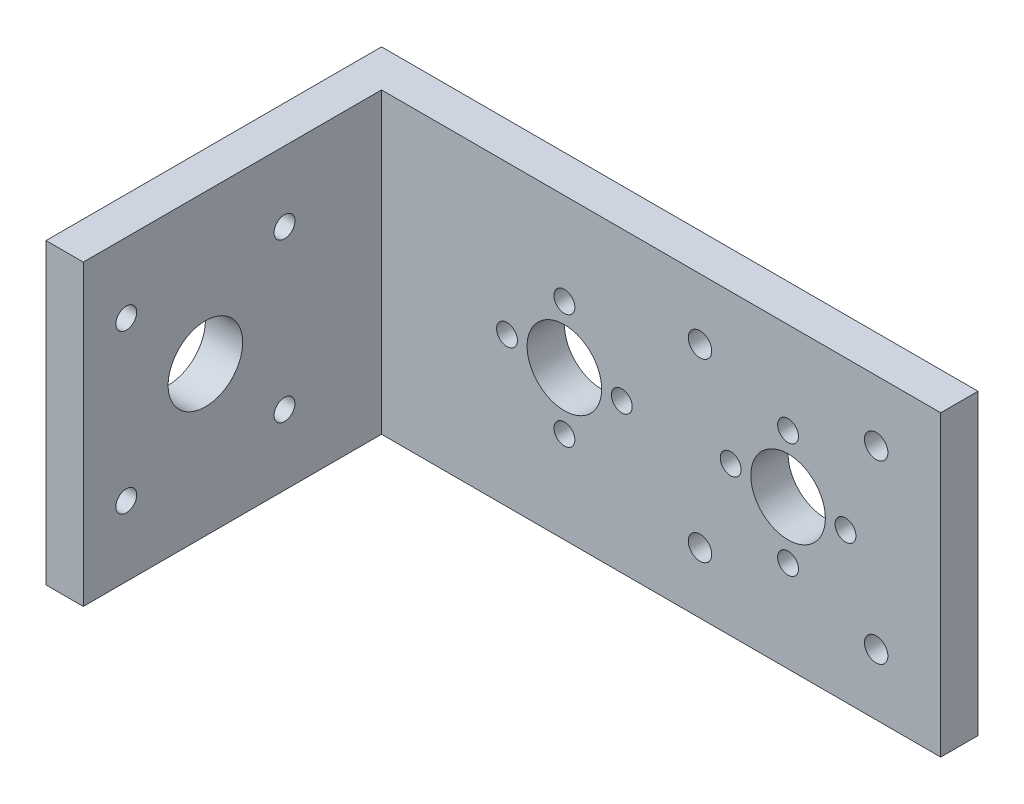
from build123d import *

# Parameters (mm, degrees)
SKETCH1_W                 = 101.6
SKETCH1_H                 = 50.8
BOSS_EXTRUDE1_DEPTH       = 6.35
SKETCH2_R                 = 2
CUT_EXTRUDE1_DEPTH        = 6.35
SKETCH3_R                 = 1.778
CUT_EXTRUDE2_DEPTH        = 6.35
SKETCH4_R                 = 6.35
CUT_EXTRUDE3_DEPTH        = 6.35
CIRPATTERN1_COUNT         = 4
SKETCH5_W                 = 6.35
SKETCH5_H                 = 50.8
BOSS_EXTRUDE2_DEPTH       = 50.8
SKETCH6_R                 = 6.35
CUT_EXTRUDE4_DEPTH        = 6.35
SKETCH7_R                 = 1.778
CUT_EXTRUDE5_DEPTH        = 6.35
CIRPATTERN2_COUNT         = 4
LPATTERN1_COUNT           = 2
LPATTERN1_PITCH           = 38.1
LPATTERN1_COPY_1_SKETCH_R = 1.778
LPATTERN1_COPY_1_DEPTH    = 6.35
LPATTERN1_COPY_2_SKETCH_R = 1.778
LPATTERN1_COPY_2_DEPTH    = 6.35
LPATTERN1_COPY_3_SKETCH_R = 1.778
LPATTERN1_COPY_3_DEPTH    = 6.35
LPATTERN1_COPY_4_SKETCH_R = 1.778
LPATTERN1_COPY_4_DEPTH    = 6.35


with BuildPart() as part:
    # Sketch1 → Boss-Extrude1 (new body)
    with BuildSketch(Plane.XY):
        with Locations((-50.8, -25.4)):
            Rectangle(SKETCH1_W, SKETCH1_H)
    extrude(amount=BOSS_EXTRUDE1_DEPTH)

    # Sketch2 → Cut-Extrude1 (cut)
    with BuildSketch(Plane.XY.offset(6.35)):
        with Locations((-11, -10.400000028)):
            Circle(SKETCH2_R)
        with Locations((-41, -10.400000028)):
            Circle(SKETCH2_R)
        with Locations((-41, -40.399999972)):
            Circle(SKETCH2_R)
        with Locations((-11, -40.399999972)):
            Circle(SKETCH2_R)
    extrude(amount=-CUT_EXTRUDE1_DEPTH, mode=Mode.SUBTRACT)

    # Sketch3 → Cut-Extrude2 (cut)
    with BuildSketch(Plane.XY.offset(6.35)):
        with Locations((-26, -15.621)):
            Circle(SKETCH3_R)
    cut_extrude2 = extrude(amount=-CUT_EXTRUDE2_DEPTH, mode=Mode.SUBTRACT)

    # Sketch4 → Cut-Extrude3 (cut)
    with BuildSketch(Plane.XY.offset(6.35)):
        with Locations((-26, -25.4)):
            Circle(SKETCH4_R)
    cut_extrude3 = extrude(amount=-CUT_EXTRUDE3_DEPTH, mode=Mode.SUBTRACT)

    # CirPattern1: Cut-Extrude2 ×4 about axis
    cirpattern1_axis = Axis((-26, -25.4, 6.35), (0, 0, 1))
    for i in range(1, CIRPATTERN1_COUNT):
        add(cut_extrude2.rotate(cirpattern1_axis, i * 360 / CIRPATTERN1_COUNT), mode=Mode.SUBTRACT)

    # Sketch5 → Boss-Extrude2 (add)
    with BuildSketch(Plane.XY.offset(6.35)):
        with Locations((-98.425, -25.4)):
            Rectangle(SKETCH5_W, SKETCH5_H)
    extrude(amount=BOSS_EXTRUDE2_DEPTH)

    # Sketch6 → Cut-Extrude4 (cut)
    with BuildSketch(Plane(origin=(-95.25, 0, 0), x_dir=(0, 0, -1), z_dir=(1, 0, 0))):
        with Locations((-36.35, -25.4)):
            Circle(SKETCH6_R)
    extrude(amount=-CUT_EXTRUDE4_DEPTH, mode=Mode.SUBTRACT)

    # Sketch7 → Cut-Extrude5 (cut)
    with BuildSketch(Plane(origin=(-95.25, 0, 0), x_dir=(0, 0, -1), z_dir=(1, 0, 0))):
        with Locations((-49.8247, -11.9253)):
            Circle(SKETCH7_R)
    cut_extrude5 = extrude(amount=-CUT_EXTRUDE5_DEPTH, mode=Mode.SUBTRACT)

    # CirPattern2: Cut-Extrude5 ×4 about axis
    cirpattern2_axis = Axis((-95.25, -25.4, 36.35), (1, 0, 0))
    for i in range(1, CIRPATTERN2_COUNT):
        add(cut_extrude5.rotate(cirpattern2_axis, i * 360 / CIRPATTERN2_COUNT), mode=Mode.SUBTRACT)

    # LPattern1: Cut-Extrude3 ×2
    with Locations(*[(-i * LPATTERN1_PITCH, 0, 0) for i in range(1, LPATTERN1_COUNT)]):
        add(cut_extrude3, mode=Mode.SUBTRACT)

    # LPattern1 copy 1 sketch → LPattern1 copy 1 (cut)
    with BuildSketch(Plane(origin=(-89.5, 0.6, 6.35), x_dir=(0, 1, 0), z_dir=(0, 0, 1))):
        with Locations((-26, -15.621)):
            Circle(LPATTERN1_COPY_1_SKETCH_R)
    extrude(amount=-LPATTERN1_COPY_1_DEPTH, mode=Mode.SUBTRACT)

    # LPattern1 copy 2 sketch → LPattern1 copy 2 (cut)
    with BuildSketch(Plane(origin=(-90.1, -50.8, 6.35), x_dir=(-1, 0, 0), z_dir=(0, 0, 1))):
        with Locations((-26, -15.621)):
            Circle(LPATTERN1_COPY_2_SKETCH_R)
    extrude(amount=-LPATTERN1_COPY_2_DEPTH, mode=Mode.SUBTRACT)

    # LPattern1 copy 3 sketch → LPattern1 copy 3 (cut)
    with BuildSketch(Plane(origin=(-38.7, -51.4, 6.35), x_dir=(0, -1, 0), z_dir=(0, 0, 1))):
        with Locations((-26, -15.621)):
            Circle(LPATTERN1_COPY_3_SKETCH_R)
    extrude(amount=-LPATTERN1_COPY_3_DEPTH, mode=Mode.SUBTRACT)

    # LPattern1 copy 4 sketch → LPattern1 copy 4 (cut)
    with BuildSketch(Plane(origin=(-38.1, 0, 6.35), x_dir=(1, 0, 0), z_dir=(0, 0, 1))):
        with Locations((-26, -15.621)):
            Circle(LPATTERN1_COPY_4_SKETCH_R)
    extrude(amount=-LPATTERN1_COPY_4_DEPTH, mode=Mode.SUBTRACT)


solid = part.part
